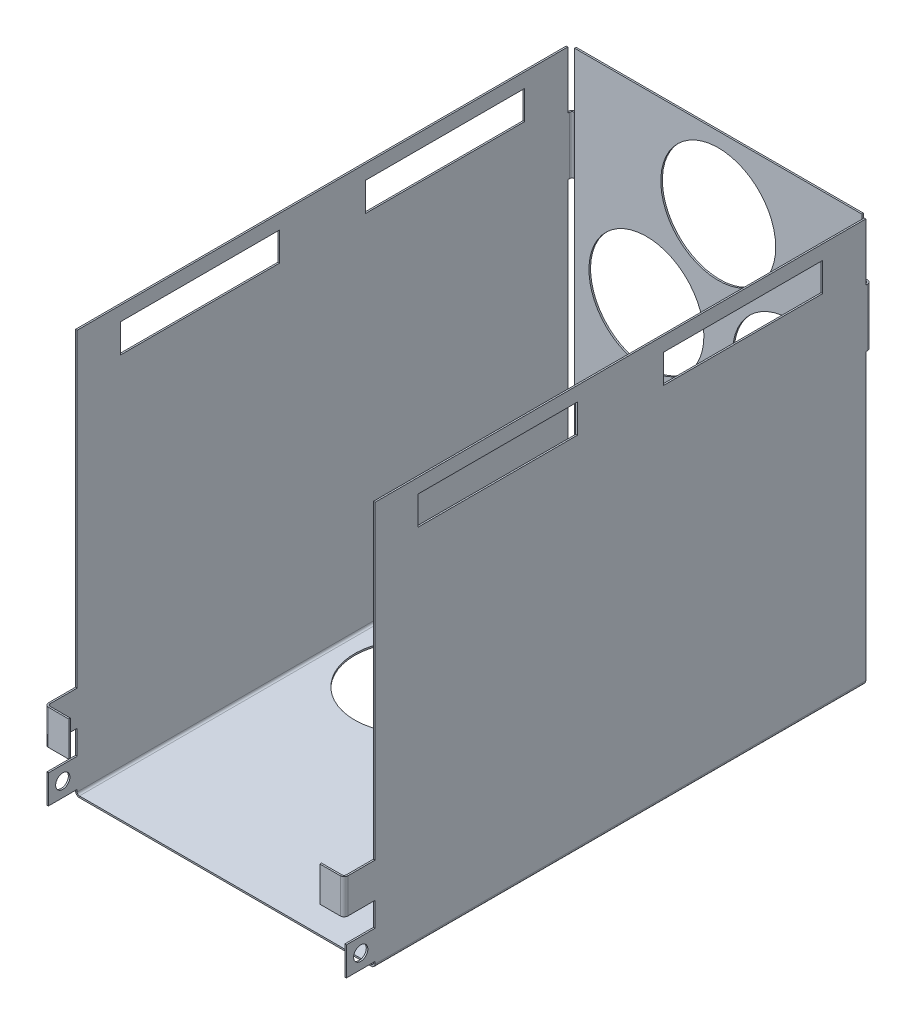
from build123d import *

# Parameters (mm, degrees)
SKETCH2_W           = 127
SKETCH2_H           = 215.9
BASE_FLANGE1_DEPTH  = 0.7
EDGE_FLANGE4_DEPTH  = 127
EDGE_FLANGE5_DEPTH  = 216.9
EDGE_FLANGE6_DEPTH  = 216.9
EDGE_FLANGE7_DEPTH  = 25.4
EDGE_FLANGE9_DEPTH  = 25.4
EDGE_FLANGE10_DEPTH = 15.4
EDGE_FLANGE11_DEPTH = 15.4
SKETCH76_W          = 12.7
SKETCH76_H          = 12.7
TAB1_DEPTH          = 0.7
SKETCH79_W          = 12.7
SKETCH79_H          = 12.7
TAB2_DEPTH          = 0.7
SKETCH86_R          = 3.15
CUT_EXTRUDE3_DEPTH  = 253.866214627
SKETCH87_W          = 70.35
SKETCH87_H          = 12.7
CUT_EXTRUDE4_DEPTH  = 253.866214627
SKETCH88_R          = 25.4
CUT_EXTRUDE5_DEPTH  = 10
SKETCH90_R          = 25.4
CUT_EXTRUDE6_DEPTH  = 300.389111358


# Sheet-metal steps are written as plain solids
with BuildPart() as part:
    # Sketch2 → Base-Flange1 (new body)
    with BuildSketch(Plane(origin=(0, 0, 0), x_dir=(1, 0, 0), z_dir=(0, 1, 0))):
        Rectangle(SKETCH2_W, SKETCH2_H)
    extrude(amount=-BASE_FLANGE1_DEPTH)

    # Edge-Flange4 section (across the edge) → Edge-Flange4 (add)
    with BuildSketch(Plane(origin=(63.5, 0, -109.95), x_dir=(0, 0, 1), z_dir=(-1, 0, 0))):
        with BuildLine():
            Line((-0.7, 1), (-0.7, 177.8))
            Line((-0.7, 177.8), (0, 177.8))
            Line((0, 177.8), (0, 1))
            ThreePointArc((0, 1), (0.292893219, 0.292893219), (1, 0))
            Line((1, 0), (2, 0))
            Line((2, 0), (2, -0.7))
            Line((2, -0.7), (1, -0.7))
            ThreePointArc((1, -0.7), (-0.202081528, -0.202081528), (-0.7, 1))
        make_face()
    extrude(amount=EDGE_FLANGE4_DEPTH)

    # Edge-Flange5 section (across the edge) → Edge-Flange5 (add)
    with BuildSketch(Plane(origin=(-65.5, 0, -108.95), x_dir=(1, 0, 0), z_dir=(0, 0, 1))):
        with BuildLine():
            Line((-0.7, 1), (-0.7, 177.8))
            Line((-0.7, 177.8), (0, 177.8))
            Line((0, 177.8), (0, 1))
            ThreePointArc((0, 1), (0.292893219, 0.292893219), (1, 0))
            Line((1, 0), (2, 0))
            Line((2, 0), (2, -0.7))
            Line((2, -0.7), (1, -0.7))
            ThreePointArc((1, -0.7), (-0.202081528, -0.202081528), (-0.7, 1))
        make_face()
    extrude(amount=EDGE_FLANGE5_DEPTH)

    # Edge-Flange6 section (across the edge) → Edge-Flange6 (add)
    with BuildSketch(Plane(origin=(65.5, 0, 107.95), x_dir=(-1, 0, 0), z_dir=(0, 0, -1))):
        with BuildLine():
            Line((-0.7, 1), (-0.7, 177.8))
            Line((-0.7, 177.8), (0, 177.8))
            Line((0, 177.8), (0, 1))
            ThreePointArc((0, 1), (0.292893219, 0.292893219), (1, 0))
            Line((1, 0), (2, 0))
            Line((2, 0), (2, -0.7))
            Line((2, -0.7), (1, -0.7))
            ThreePointArc((1, -0.7), (-0.202081528, -0.202081528), (-0.7, 1))
        make_face()
    extrude(amount=EDGE_FLANGE6_DEPTH)

    # Edge-Flange7 section (across the edge) → Edge-Flange7 (add)
    with BuildSketch(Plane(origin=(-65.5, 127, -110.75), x_dir=(0, 0, 1), z_dir=(0, 1, 0))):
        with BuildLine():
            Line((-0.7, 1), (-0.7, 24.7))
            Line((-0.7, 24.7), (0, 24.7))
            Line((0, 24.7), (0, 1))
            ThreePointArc((0, 1), (0.292893219, 0.292893219), (1, 0))
            Line((1, 0), (1.8, 0))
            Line((1.8, 0), (1.8, -0.7))
            Line((1.8, -0.7), (1, -0.7))
            ThreePointArc((1, -0.7), (-0.202081528, -0.202081528), (-0.7, 1))
        make_face()
    extrude(amount=EDGE_FLANGE7_DEPTH)

    # Edge-Flange9 section (across the edge) → Edge-Flange9 (add)
    with BuildSketch(Plane(origin=(65.5, 152.4, -110.75), x_dir=(0, 0, 1), z_dir=(0, -1, 0))):
        with BuildLine():
            Line((-0.7, 1), (-0.7, 24.7))
            Line((-0.7, 24.7), (0, 24.7))
            Line((0, 24.7), (0, 1))
            ThreePointArc((0, 1), (0.292893219, 0.292893219), (1, 0))
            Line((1, 0), (1.8, 0))
            Line((1.8, 0), (1.8, -0.7))
            Line((1.8, -0.7), (1, -0.7))
            ThreePointArc((1, -0.7), (-0.202081528, -0.202081528), (-0.7, 1))
        make_face()
    extrude(amount=EDGE_FLANGE9_DEPTH)

    # Edge-Flange10 section (across the edge) → Edge-Flange10 (add)
    with BuildSketch(Plane(origin=(65.5, 25.4, 120.95), x_dir=(0, 0, -1), z_dir=(0, 1, 0))):
        with BuildLine():
            Line((-0.7, 1), (-0.7, 10))
            Line((-0.7, 10), (0, 10))
            Line((0, 10), (0, 1))
            ThreePointArc((0, 1), (0.292893219, 0.292893219), (1, 0))
            Line((1, 0), (13, 0))
            Line((13, 0), (13, -0.7))
            Line((13, -0.7), (1, -0.7))
            ThreePointArc((1, -0.7), (-0.202081528, -0.202081528), (-0.7, 1))
        make_face()
    extrude(amount=EDGE_FLANGE10_DEPTH)

    # Edge-Flange11 section (across the edge) → Edge-Flange11 (add)
    with BuildSketch(Plane(origin=(-65.5, 40.8, 120.95), x_dir=(0, 0, -1), z_dir=(0, -1, 0))):
        with BuildLine():
            Line((-0.7, 1), (-0.7, 10))
            Line((-0.7, 10), (0, 10))
            Line((0, 10), (0, 1))
            ThreePointArc((0, 1), (0.292893219, 0.292893219), (1, 0))
            Line((1, 0), (13, 0))
            Line((13, 0), (13, -0.7))
            Line((13, -0.7), (1, -0.7))
            ThreePointArc((1, -0.7), (-0.202081528, -0.202081528), (-0.7, 1))
        make_face()
    extrude(amount=EDGE_FLANGE11_DEPTH)

    # Sketch76 → Tab1 (add)
    with BuildSketch(Plane.ZY.offset(66.2)):
        with Locations((114.3, 8.35)):
            Rectangle(SKETCH76_W, SKETCH76_H)
    extrude(amount=-TAB1_DEPTH)

    # Sketch79 → Tab2 (add)
    with BuildSketch(Plane(origin=(66.2, 0, 0), x_dir=(0, 0, -1), z_dir=(1, 0, 0))):
        with Locations((-114.3, 8.35)):
            Rectangle(SKETCH79_W, SKETCH79_H)
    extrude(amount=-TAB2_DEPTH)

    # Sketch86 → Cut-Extrude3 (cut, through all)
    with BuildSketch(Plane(origin=(66.2, 0, 0), x_dir=(0, 0, -1), z_dir=(1, 0, 0))):
        with Locations(Location((-114.3, 8.35, 0), (0, 0, 90))):
            Circle(SKETCH86_R)
    extrude(amount=-CUT_EXTRUDE3_DEPTH, mode=Mode.SUBTRACT)

    # Sketch87 → Cut-Extrude4 (cut, through all)
    with BuildSketch(Plane.ZY.offset(66.2)):
        with Locations((-54.725, 165.1)):
            Rectangle(SKETCH87_W, SKETCH87_H)
        with Locations((53.725, 165.0975)):
            Rectangle(SKETCH87_W, SKETCH87_H)
    extrude(amount=-CUT_EXTRUDE4_DEPTH, mode=Mode.SUBTRACT)

    # Sketch88 → Cut-Extrude5 (cut)
    with BuildSketch(Plane(origin=(0, 0, 0), x_dir=(1, 0, 0), z_dir=(0, 1, 0))):
        with Locations(Location((-32.75, 70.85, 0), (0, 0, 270))):
            Circle(SKETCH88_R)
        with Locations(Location((32.75, 70.85, 0), (0, 0, 270))):
            Circle(SKETCH88_R)
        with Locations(Location((-32.75, 7.35, 0), (0, 0, 270))):
            Circle(SKETCH88_R)
        with Locations(Location((32.75, 7.35, 0), (0, 0, 270))):
            Circle(SKETCH88_R)
    extrude(amount=-CUT_EXTRUDE5_DEPTH, mode=Mode.SUBTRACT)

    # Sketch90 → Cut-Extrude6 (cut, through all)
    with BuildSketch(Plane.XY.offset(-109.95)):
        with Locations((-31.75, 39.1)):
            Circle(SKETCH90_R)
        with Locations((31.75, 39.1)):
            Circle(SKETCH90_R)
        with Locations((-31.75, 96.25)):
            Circle(SKETCH90_R)
        with Locations((31.75, 96.25)):
            Circle(SKETCH90_R)
        with Locations((0, 146.05)):
            Circle(SKETCH90_R)
    extrude(amount=-CUT_EXTRUDE6_DEPTH, mode=Mode.SUBTRACT)


solid = part.part
